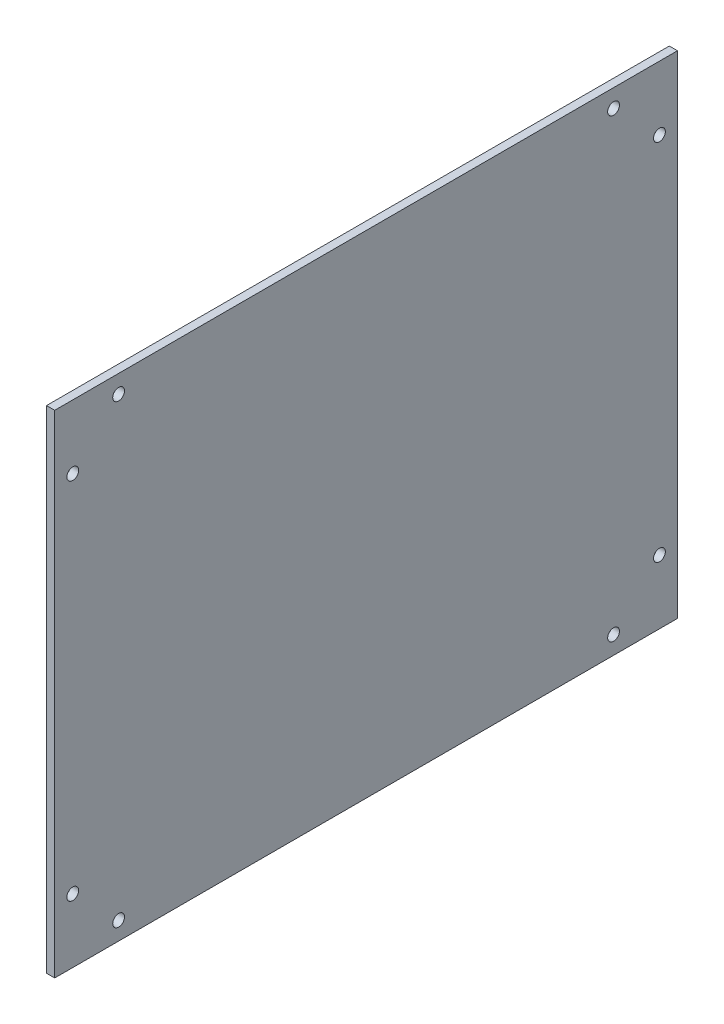
from build123d import *

# Parameters (mm, degrees)
SKETCH1_W           = 241.3
SKETCH1_H           = 190.5
BOSS_EXTRUDE1_DEPTH = 3.175
SKETCH2_R           = 2.286
CUT_EXTRUDE1_DEPTH  = 308.450842616


with BuildPart() as part:
    # Sketch1 → Boss-Extrude1 (new body)
    with BuildSketch(Plane(origin=(0, 0, 0), x_dir=(0, 0, -1), z_dir=(1, 0, 0))):
        with Locations((120.65, 95.25)):
            Rectangle(SKETCH1_W, SKETCH1_H)
    extrude(amount=BOSS_EXTRUDE1_DEPTH)

    # Sketch2 → Cut-Extrude1 (cut, through all)
    with BuildSketch(Plane(origin=(3.175, 0, 0), x_dir=(0, 0, -1), z_dir=(1, 0, 0))):
        with Locations((216.535, 6.985)):
            Circle(SKETCH2_R)
        with Locations((234.315, 24.765)):
            Circle(SKETCH2_R)
        with Locations((234.315, 165.735)):
            Circle(SKETCH2_R)
        with Locations((216.535, 183.515)):
            Circle(SKETCH2_R)
        with Locations((24.765, 183.515)):
            Circle(SKETCH2_R)
        with Locations((6.985, 165.735)):
            Circle(SKETCH2_R)
        with Locations((6.985, 24.765)):
            Circle(SKETCH2_R)
        with Locations((24.765, 6.985)):
            Circle(SKETCH2_R)
    extrude(amount=-CUT_EXTRUDE1_DEPTH, mode=Mode.SUBTRACT)


solid = part.part
